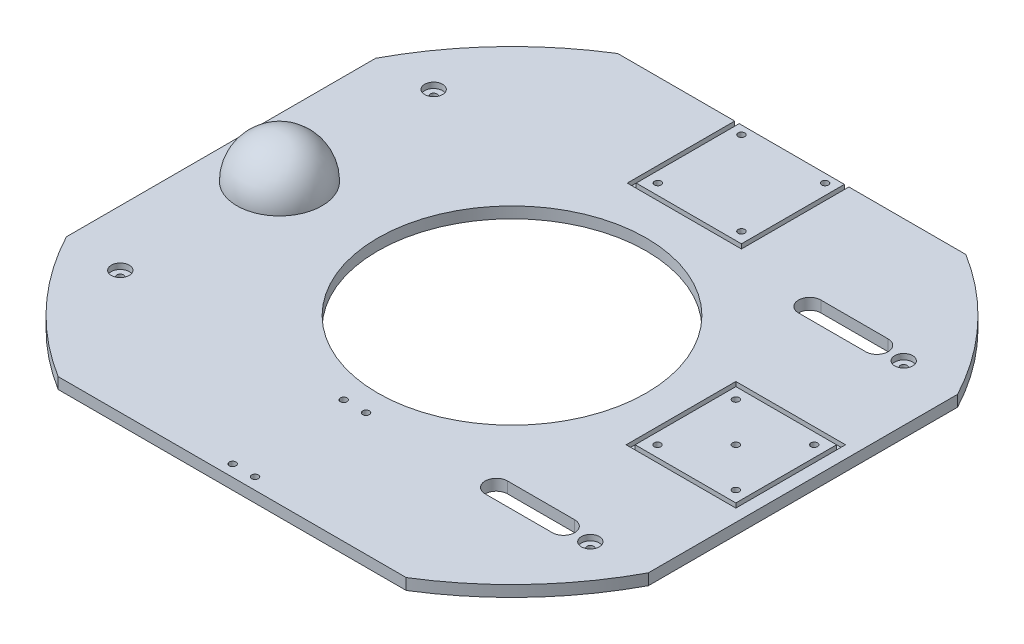
from build123d import *

# Parameters (mm, degrees)
SKETCH_1_W           = 200
SKETCH_1_H           = 150
EXTRUDE_1_DEPTH      = 5
SKETCH_2_W           = 280
SKETCH_2_H           = 250
SKETCH_2_R           = 1.5
EXTRUDE_2_DEPTH      = 5
SKETCH_3_R           = 11.5
CUT_EXTRUDE_1_DEPTH  = 5
SKETCH_4_R           = 3
SKETCH_4_R_2         = 1.5
EXTRUDE_3_DEPTH      = 13
CUT_EXTRUDE_4_REACH  = 190.133
SKETCH_8_R           = 1.5
CUT_EXTRUDE_5_REACH  = 190.133
SKETCH_9_W           = 10
SKETCH_9_H           = 250
SKETCH_10_W          = 41.454704644
SKETCH_10_H          = 62.998147515
CUT_EXTRUDE_6_DEPTH  = 13
CUT_EXTRUDE_7_REACH  = 182.416
SKETCH_11_R          = 1.5
CUT_EXTRUDE_8_DEPTH  = 2
CUT_EXTRUDE_9_REACH  = 182.416
SKETCH_13_R          = 30
CUT_EXTRUDE_10_REACH = 182.416
SKETCH_17_R          = 4
CUT_EXTRUDE_11_DEPTH = 2.5
SKETCH_18_W          = 49
SKETCH_18_H          = 49
SKETCH_18_W_2        = 45
SKETCH_18_H_2        = 45
CUT_EXTRUDE_12_DEPTH = 2
SKETCH_19_R          = 1.5
CUT_EXTRUDE_13_DEPTH = 182.344975116
CUT_EXTRUDE_14_REACH = 183.345
SKETCH_20_R          = 60
SKETCH_21_W          = 29.69805515
SKETCH_21_H          = 23
EXTRUDE_4_DEPTH      = 5
CUT_EXTRUDE_15_REACH = 183.345


# Read off the part's stored shape, not the designer's step: 旋转4
with BuildPart() as part:
    # 草图1 → 凸台-拉伸1 (new body)
    with BuildSketch(Plane(origin=(0, 0, 0), x_dir=(1, 0, 0), z_dir=(0, 1, 0))):
        Rectangle(SKETCH_1_W, SKETCH_1_H)
    extrude(amount=EXTRUDE_1_DEPTH)

    # 草图2 → 凸台-拉伸2 (add)
    with BuildSketch(Plane(origin=(0, 5, 0), x_dir=(1, 0, 0), z_dir=(0, 1, 0))):
        Rectangle(SKETCH_2_W, SKETCH_2_H)
        with Locations(Location((-105, 70, 0), (0, 0, 270))):
            Circle(SKETCH_2_R, mode=Mode.SUBTRACT)
        with Locations(Location((-105, -70, 0), (0, 0, 270))):
            Circle(SKETCH_2_R, mode=Mode.SUBTRACT)
        with Locations(Location((105, 70, 0), (0, 0, 270))):
            Circle(SKETCH_2_R, mode=Mode.SUBTRACT)
        with Locations(Location((105, -70, 0), (0, 0, 270))):
            Circle(SKETCH_2_R, mode=Mode.SUBTRACT)
    extrude(amount=-EXTRUDE_2_DEPTH)

    # 草图3 → 切除-拉伸1 (cut)
    with BuildSketch(Plane(origin=(0, 5, 0), x_dir=(1, 0, 0), z_dir=(0, 1, 0))):
        with Locations(Location((0, -85, 0), (0, 0, 270))):
            Circle(SKETCH_3_R)
    extrude(amount=-CUT_EXTRUDE_1_DEPTH, mode=Mode.SUBTRACT)

    # 草图4 → 凸台-拉伸3 (add)
    # profile 1 of 4: a face of its own
    with BuildSketch(Plane.XZ):
        with Locations(Location((-5, 119.8, 0), (0, 0, 90))):
            Circle(SKETCH_4_R)
        with Locations(Location((-5, 119.8, 0), (0, 0, 90))):
            Circle(SKETCH_4_R_2, mode=Mode.SUBTRACT)
    # profile 2 of 4: a face of its own
    with BuildSketch(Plane.XZ):
        with Locations(Location((5, 119.8, 0), (0, 0, 90))):
            Circle(SKETCH_4_R)
        with Locations(Location((5, 119.8, 0), (0, 0, 90))):
            Circle(SKETCH_4_R_2, mode=Mode.SUBTRACT)
    # profile 3 of 4: a face of its own
    with BuildSketch(Plane.XZ):
        with Locations(Location((5, 70.2, 0), (0, 0, 90))):
            Circle(SKETCH_4_R)
        with Locations(Location((5, 70.2, 0), (0, 0, 90))):
            Circle(SKETCH_4_R_2, mode=Mode.SUBTRACT)
    # profile 4 of 4: a face of its own
    with BuildSketch(Plane.XZ):
        with Locations(Location((-5, 70.2, 0), (0, 0, 90))):
            Circle(SKETCH_4_R)
        with Locations(Location((-5, 70.2, 0), (0, 0, 90))):
            Circle(SKETCH_4_R_2, mode=Mode.SUBTRACT)
    extrude(amount=EXTRUDE_3_DEPTH)

    # 草图8 → 切除-拉伸4 (cut, up to next)
    with BuildSketch(Plane.XZ, mode=Mode.PRIVATE) as cut_extrude_4_sk1:
        with Locations(Location((5, 119.8, 0), (0, 0, 90))):
            Circle(SKETCH_8_R)
    cut_extrude_4_tool1 = extrude(cut_extrude_4_sk1.sketch, amount=-CUT_EXTRUDE_4_REACH, mode=Mode.PRIVATE) & part.part
    # 草图8 → 切除-拉伸4 (cut, up to next)
    with BuildSketch(Plane.XZ, mode=Mode.PRIVATE) as cut_extrude_4_sk2:
        with Locations(Location((5, 70.2, 0), (0, 0, 90))):
            Circle(SKETCH_8_R)
    cut_extrude_4_tool2 = extrude(cut_extrude_4_sk2.sketch, amount=-CUT_EXTRUDE_4_REACH, mode=Mode.PRIVATE) & part.part
    # 草图8 → 切除-拉伸4 (cut, up to next)
    with BuildSketch(Plane.XZ, mode=Mode.PRIVATE) as cut_extrude_4_sk3:
        with Locations(Location((-5, 119.8, 0), (0, 0, 90))):
            Circle(SKETCH_8_R)
    cut_extrude_4_tool3 = extrude(cut_extrude_4_sk3.sketch, amount=-CUT_EXTRUDE_4_REACH, mode=Mode.PRIVATE) & part.part
    # 草图8 → 切除-拉伸4 (cut, up to next)
    with BuildSketch(Plane.XZ, mode=Mode.PRIVATE) as cut_extrude_4_sk4:
        with Locations(Location((-5, 70.2, 0), (0, 0, 90))):
            Circle(SKETCH_8_R)
    cut_extrude_4_tool4 = extrude(cut_extrude_4_sk4.sketch, amount=-CUT_EXTRUDE_4_REACH, mode=Mode.PRIVATE) & part.part
    add(cut_extrude_4_tool1.solids().sort_by_distance((5, 0, 119.8))[0], mode=Mode.SUBTRACT)
    add(cut_extrude_4_tool2.solids().sort_by_distance((5, 0, 70.2))[0], mode=Mode.SUBTRACT)
    add(cut_extrude_4_tool3.solids().sort_by_distance((-5, 0, 119.8))[0], mode=Mode.SUBTRACT)
    add(cut_extrude_4_tool4.solids().sort_by_distance((-5, 0, 70.2))[0], mode=Mode.SUBTRACT)

    # 草图9 → 切除-拉伸5 (cut, up to next)
    with BuildSketch(Plane.XZ, mode=Mode.PRIVATE) as cut_extrude_5_sk1:
        with Locations((-135, 0)):
            Rectangle(SKETCH_9_W, SKETCH_9_H)
    cut_extrude_5_tool1 = extrude(cut_extrude_5_sk1.sketch, amount=-CUT_EXTRUDE_5_REACH, mode=Mode.PRIVATE) & part.part
    # 草图9 → 切除-拉伸5 (cut, up to next)
    with BuildSketch(Plane.XZ, mode=Mode.PRIVATE) as cut_extrude_5_sk2:
        with Locations((135, 0)):
            Rectangle(SKETCH_9_W, SKETCH_9_H)
    cut_extrude_5_tool2 = extrude(cut_extrude_5_sk2.sketch, amount=-CUT_EXTRUDE_5_REACH, mode=Mode.PRIVATE) & part.part
    add(cut_extrude_5_tool1.solids().sort_by_distance((-135, 0, 0))[0], mode=Mode.SUBTRACT)
    add(cut_extrude_5_tool2.solids().sort_by_distance((135, 0, 0))[0], mode=Mode.SUBTRACT)

    # 草图10 → 切除-拉伸6 (cut)
    with BuildSketch(Plane.XZ):
        with Locations((1.571094054, 93.500926243)):
            Rectangle(SKETCH_10_W, SKETCH_10_H)
    extrude(amount=CUT_EXTRUDE_6_DEPTH, mode=Mode.SUBTRACT)

    # 草图11 → 切除-拉伸7 (cut, up to next)
    with BuildSketch(Plane(origin=(0, 5, 0), x_dir=(1, 0, 0), z_dir=(0, 1, 0)), mode=Mode.PRIVATE) as cut_extrude_7_sk1:
        with Locations(Location((-18.68, 121.18, 0), (0, 0, 270))):
            Circle(SKETCH_11_R)
    cut_extrude_7_tool1 = extrude(cut_extrude_7_sk1.sketch, amount=-CUT_EXTRUDE_7_REACH, mode=Mode.PRIVATE) & part.part
    # 草图11 → 切除-拉伸7 (cut, up to next)
    with BuildSketch(Plane(origin=(0, 5, 0), x_dir=(1, 0, 0), z_dir=(0, 1, 0)), mode=Mode.PRIVATE) as cut_extrude_7_sk2:
        with Locations(Location((18.68, 121.18, 0), (0, 0, 270))):
            Circle(SKETCH_11_R)
    cut_extrude_7_tool2 = extrude(cut_extrude_7_sk2.sketch, amount=-CUT_EXTRUDE_7_REACH, mode=Mode.PRIVATE) & part.part
    # 草图11 → 切除-拉伸7 (cut, up to next)
    with BuildSketch(Plane(origin=(0, 5, 0), x_dir=(1, 0, 0), z_dir=(0, 1, 0)), mode=Mode.PRIVATE) as cut_extrude_7_sk3:
        with Locations(Location((18.68, 83.82, 0), (0, 0, 270))):
            Circle(SKETCH_11_R)
    cut_extrude_7_tool3 = extrude(cut_extrude_7_sk3.sketch, amount=-CUT_EXTRUDE_7_REACH, mode=Mode.PRIVATE) & part.part
    # 草图11 → 切除-拉伸7 (cut, up to next)
    with BuildSketch(Plane(origin=(0, 5, 0), x_dir=(1, 0, 0), z_dir=(0, 1, 0)), mode=Mode.PRIVATE) as cut_extrude_7_sk4:
        with Locations(Location((-18.68, 83.82, 0), (0, 0, 270))):
            Circle(SKETCH_11_R)
    cut_extrude_7_tool4 = extrude(cut_extrude_7_sk4.sketch, amount=-CUT_EXTRUDE_7_REACH, mode=Mode.PRIVATE) & part.part
    add(cut_extrude_7_tool1.solids().sort_by_distance((-18.68, 5, -121.18))[0], mode=Mode.SUBTRACT)
    add(cut_extrude_7_tool2.solids().sort_by_distance((18.68, 5, -121.18))[0], mode=Mode.SUBTRACT)
    add(cut_extrude_7_tool3.solids().sort_by_distance((18.68, 5, -83.82))[0], mode=Mode.SUBTRACT)
    add(cut_extrude_7_tool4.solids().sort_by_distance((-18.68, 5, -83.82))[0], mode=Mode.SUBTRACT)

    # 草图12 → 切除-拉伸8 (cut)
    with BuildSketch(Plane(origin=(0, 5, 0), x_dir=(1, 0, 0), z_dir=(0, 1, 0))):
        Polygon((-23.5, 79), (23.5, 79), (23.5, 125), (25.5, 125), (25.5, 77), (-25.5, 77), (-25.5, 125), (-23.5, 125), align=None)
    extrude(amount=-CUT_EXTRUDE_8_DEPTH, mode=Mode.SUBTRACT)

    # 草图13 → 切除-拉伸9 (cut, up to next)
    with BuildSketch(Plane(origin=(0, 5, 0), x_dir=(1, 0, 0), z_dir=(0, 1, 0)), mode=Mode.PRIVATE) as cut_extrude_9_sk1:
        with Locations(Location((0, 0, 0), (0, 0, 270))):
            Circle(SKETCH_13_R)
    cut_extrude_9_tool1 = extrude(cut_extrude_9_sk1.sketch, amount=-CUT_EXTRUDE_9_REACH, mode=Mode.PRIVATE) & part.part
    add(cut_extrude_9_tool1.solids().sort_by_distance((0, 5, 0))[0], mode=Mode.SUBTRACT)

    # 草图14 → 切除-拉伸10 (cut, up to next)
    with BuildSketch(Plane(origin=(0, 5, 0), x_dir=(1, 0, 0), z_dir=(0, 1, 0)), mode=Mode.PRIVATE) as cut_extrude_10_sk1:
        with BuildLine():
            Line((77.75, 125), (130, 125))
            Line((130, 125), (130, 69.065639069))
            ThreePointArc((130, 69.065639069), (107.574061968, 100.488226633), (77.75, 125))
        make_face()
    cut_extrude_10_tool1 = extrude(cut_extrude_10_sk1.sketch, amount=-CUT_EXTRUDE_10_REACH, mode=Mode.PRIVATE) & part.part
    # 草图14 → 切除-拉伸10 (cut, up to next)
    with BuildSketch(Plane(origin=(0, 5, 0), x_dir=(1, 0, 0), z_dir=(0, 1, 0)), mode=Mode.PRIVATE) as cut_extrude_10_sk2:
        with BuildLine():
            Line((77.75, -125), (130, -125))
            Line((130, -125), (130, -69.065639069))
            ThreePointArc((130, -69.065639069), (107.574061968, -100.488226633), (77.75, -125))
        make_face()
    cut_extrude_10_tool2 = extrude(cut_extrude_10_sk2.sketch, amount=-CUT_EXTRUDE_10_REACH, mode=Mode.PRIVATE) & part.part
    # 草图14 → 切除-拉伸10 (cut, up to next)
    with BuildSketch(Plane(origin=(0, 5, 0), x_dir=(1, 0, 0), z_dir=(0, 1, 0)), mode=Mode.PRIVATE) as cut_extrude_10_sk3:
        with BuildLine():
            Line((-130, -125), (-130, -69.065639069))
            ThreePointArc((-130, -69.065639069), (-107.574061968, -100.488226633), (-77.75, -125))
            Line((-77.75, -125), (-130, -125))
        make_face()
    cut_extrude_10_tool3 = extrude(cut_extrude_10_sk3.sketch, amount=-CUT_EXTRUDE_10_REACH, mode=Mode.PRIVATE) & part.part
    # 草图14 → 切除-拉伸10 (cut, up to next)
    with BuildSketch(Plane(origin=(0, 5, 0), x_dir=(1, 0, 0), z_dir=(0, 1, 0)), mode=Mode.PRIVATE) as cut_extrude_10_sk4:
        with BuildLine():
            Line((-130, 125), (-130, 69.065639069))
            ThreePointArc((-130, 69.065639069), (-107.574061968, 100.488226633), (-77.75, 125))
            Line((-77.75, 125), (-130, 125))
        make_face()
    cut_extrude_10_tool4 = extrude(cut_extrude_10_sk4.sketch, amount=-CUT_EXTRUDE_10_REACH, mode=Mode.PRIVATE) & part.part
    add(cut_extrude_10_tool1.solids().sort_by_distance((114.14156, 5, -108.066894))[0], mode=Mode.SUBTRACT)
    add(cut_extrude_10_tool2.solids().sort_by_distance((114.14156, 5, 108.066894))[0], mode=Mode.SUBTRACT)
    add(cut_extrude_10_tool3.solids().sort_by_distance((-114.14156, 5, 108.066894))[0], mode=Mode.SUBTRACT)
    add(cut_extrude_10_tool4.solids().sort_by_distance((-114.14156, 5, -108.066894))[0], mode=Mode.SUBTRACT)

    # 旋转4 outline → 旋转4 (revolve)
    with BuildSketch(Plane(origin=(-103.875, 0, 0), x_dir=(1, 0, 0), z_dir=(0, 0, 1))):
        with BuildLine():
            Line((0, 4.999999981), (19, 4.999999981))
            ThreePointArc((19, 4.999999981), (13.435028849, 18.435028836), (0, 24))
            Line((0, 24), (0, 4.999999981))
        make_face()
    revolve(axis=Axis((-103.875, 0, 0), (0, 1, 0)))

    # 草图17 → 切除-拉伸11 (cut)
    with BuildSketch(Plane(origin=(0, 5, 0), x_dir=(1, 0, 0), z_dir=(0, 1, 0))):
        with Locations(Location((-105, 70, 0), (0, 0, 270))):
            Circle(SKETCH_17_R)
        with Locations(Location((105, 70, 0), (0, 0, 270))):
            Circle(SKETCH_17_R)
        with Locations(Location((105, -70, 0), (0, 0, 270))):
            Circle(SKETCH_17_R)
        with Locations(Location((-105, -70, 0), (0, 0, 270))):
            Circle(SKETCH_17_R)
    extrude(amount=-CUT_EXTRUDE_11_DEPTH, mode=Mode.SUBTRACT)

    # 草图18 → 切除-拉伸12 (cut)
    with BuildSketch(Plane(origin=(0, 5, 0), x_dir=(1, 0, 0), z_dir=(0, 1, 0))):
        with Locations((100, 0)):
            Rectangle(SKETCH_18_W, SKETCH_18_H)
        with Locations((100, 0)):
            Rectangle(SKETCH_18_W_2, SKETCH_18_H_2, mode=Mode.SUBTRACT)
    extrude(amount=-CUT_EXTRUDE_12_DEPTH, mode=Mode.SUBTRACT)

    # 草图19 → 切除-拉伸13 (cut, through all)
    with BuildSketch(Plane(origin=(0, 5, 0), x_dir=(1, 0, 0), z_dir=(0, 1, 0))):
        with Locations(Location((117.5, 17.5, 0), (0, 0, 270))):
            Circle(SKETCH_19_R)
        with Locations(Location((82.5, 17.5, 0), (0, 0, 270))):
            Circle(SKETCH_19_R)
        with Locations(Location((117.5, -17.5, 0), (0, 0, 270))):
            Circle(SKETCH_19_R)
        with Locations(Location((82.5, -17.5, 0), (0, 0, 270))):
            Circle(SKETCH_19_R)
        with Locations(Location((100, 0, 0), (0, 0, 270))):
            Circle(SKETCH_19_R)
    extrude(amount=-CUT_EXTRUDE_13_DEPTH, mode=Mode.SUBTRACT)

    # 草图20 → 切除-拉伸14 (cut, up to next)
    with BuildSketch(Plane(origin=(0, 5, 0), x_dir=(1, 0, 0), z_dir=(0, 1, 0)), mode=Mode.PRIVATE) as cut_extrude_14_sk1:
        with Locations(Location((0, 0, 0), (0, 0, 270))):
            Circle(SKETCH_20_R)
    cut_extrude_14_tool1 = extrude(cut_extrude_14_sk1.sketch, amount=-CUT_EXTRUDE_14_REACH, mode=Mode.PRIVATE) & part.part
    add(cut_extrude_14_tool1.solids().sort_by_distance((0, 5, 0))[0], mode=Mode.SUBTRACT)

    # 草图21 → 凸台-拉伸4 (add)
    with BuildSketch(Plane(origin=(0, 5, 0), x_dir=(1, 0, 0), z_dir=(0, 1, 0))):
        with Locations((0, -85)):
            Rectangle(SKETCH_21_W, SKETCH_21_H)
    extrude(amount=-EXTRUDE_4_DEPTH)

    # 草图22 → 切除-拉伸15 (cut, up to next)
    with BuildSketch(Plane(origin=(0, 5, 0), x_dir=(1, 0, 0), z_dir=(0, 1, 0)), mode=Mode.PRIVATE) as cut_extrude_15_sk1:
        with BuildLine():
            Line((63, 75), (93, 75))
            ThreePointArc((93, 75), (98, 70), (93, 65))
            Line((93, 65), (63, 65))
            ThreePointArc((63, 65), (58, 70), (63, 75))
        make_face()
    cut_extrude_15_tool1 = extrude(cut_extrude_15_sk1.sketch, amount=-CUT_EXTRUDE_15_REACH, mode=Mode.PRIVATE) & part.part
    # 草图22 → 切除-拉伸15 (cut, up to next)
    with BuildSketch(Plane(origin=(0, 5, 0), x_dir=(1, 0, 0), z_dir=(0, 1, 0)), mode=Mode.PRIVATE) as cut_extrude_15_sk2:
        with BuildLine():
            Line((63, -75), (93, -75))
            ThreePointArc((93, -75), (98, -70), (93, -65))
            Line((93, -65), (63, -65))
            ThreePointArc((63, -65), (58, -70), (63, -75))
        make_face()
    cut_extrude_15_tool2 = extrude(cut_extrude_15_sk2.sketch, amount=-CUT_EXTRUDE_15_REACH, mode=Mode.PRIVATE) & part.part
    add(cut_extrude_15_tool1.solids().sort_by_distance((78, 5, -70))[0], mode=Mode.SUBTRACT)
    add(cut_extrude_15_tool2.solids().sort_by_distance((78, 5, 70))[0], mode=Mode.SUBTRACT)


solid = part.part
